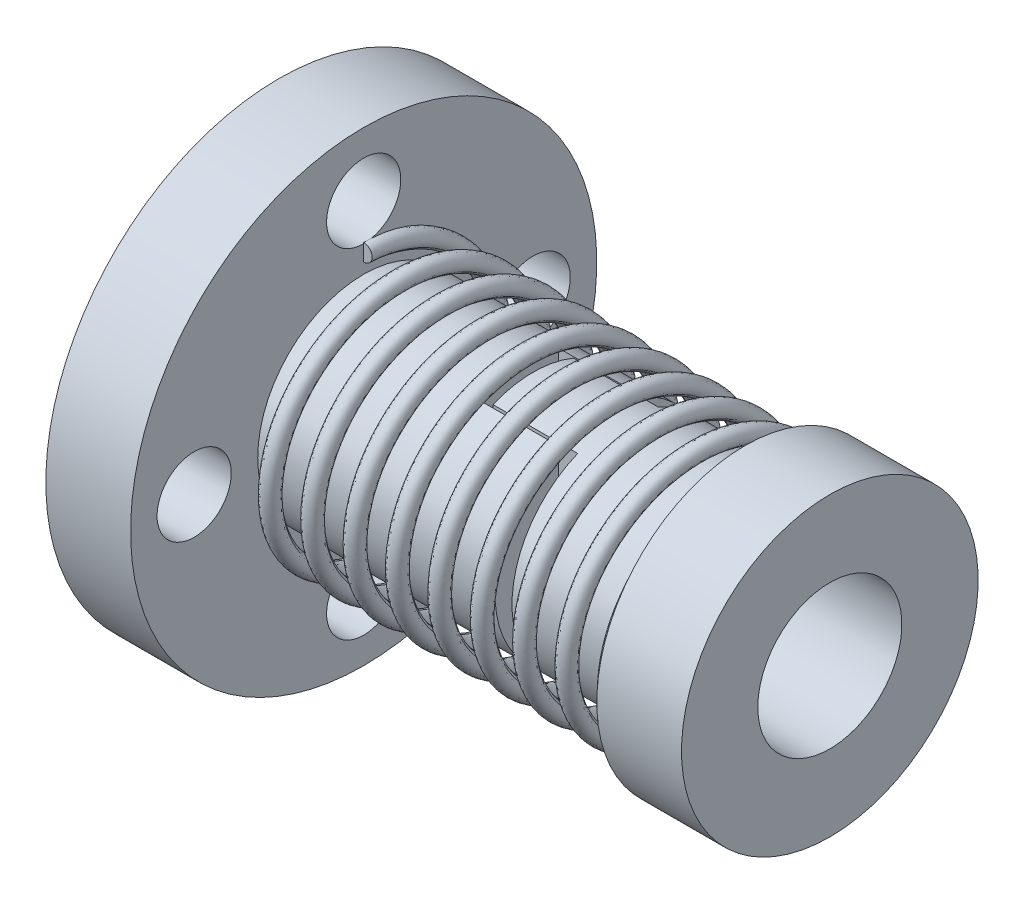
from build123d import *

# Parameters (mm, degrees)
CUT_EXTRUDE1_DEPTH      = 31.298514815
CUT_EXTRUDE1_DEPTH_BACK = 31.298514815
SWEEP1_PITCH            = 2
CUT_EXTRUDE2_DEPTH      = 31.298514888
CUT_EXTRUDE2_DEPTH_BACK = 4
SKETCH16_R              = 1.75


with BuildPart() as part:
    # Sketch1 → Revolve1 (revolve)
    with BuildSketch(Plane.XY, mode=Mode.PRIVATE) as revolve1_sk:
        Polygon((26, 0), (26, 7), (22, 7), (22, 5), (4, 5), (4, 11), (0, 11), (0, 0), align=None)
    revolve(revolve1_sk.sketch.rotate(Axis((0, 0, 0), (1, 0, 0)), 180), axis=Axis((0, 0, 0), (1, 0, 0)))

    # Sketch2 → Cut-Extrude1 (cut, two sides: drawn at the far end of the back side and taken through both)
    with BuildSketch(Plane(origin=(0, 0, 0), x_dir=(1, 0, 0), z_dir=(0, 1, 0)).offset(-CUT_EXTRUDE1_DEPTH_BACK)):
        Polygon((16, 6.9), (16, 1.9), (12, 1.9), (12, -1.9), (16, -1.9), (16, -6.9), (15.2, -6.9), (15.2, -2), (11.2, -2), (11.2, 2), (15.2, 2), (15.2, 6.9), align=None)
    extrude(amount=CUT_EXTRUDE1_DEPTH + CUT_EXTRUDE1_DEPTH_BACK, mode=Mode.SUBTRACT)


with BuildPart() as cut_extrude1_piece_1:
    # of the separate pieces the step leaves, piece 1, a body of its own (cut_extrude1_pieces)
    add(part.part.solids().sort_by_distance((11.2, -5, 0))[0])


with BuildPart() as cut_extrude1_piece_2:
    # of the separate pieces the step leaves, piece 2, a body of its own (cut_extrude1_pieces)
    add(part.part.solids().sort_by_distance((26, -7, 0))[0])


with BuildPart() as m8_tapped_hole3_tool:
    # Sketch12 → M8 Tapped Hole3 (revolve)
    with BuildSketch(Plane.ZX):
        Polygon((0, 0), (0, 26), (3.4, 26), (3.4, 0.625), (4.025, 0), align=None)
    revolve(axis=Axis((-6.35, 0, 0), (1, 0, 0)))


with BuildPart() as cut_extrude1_piece_1_1:
    add(cut_extrude1_piece_1.part)

    # M8 Tapped Hole3: cut by m8_tapped_hole3_tool
    add(m8_tapped_hole3_tool.part, mode=Mode.SUBTRACT)



with BuildPart() as cut_extrude1_piece_2_1:
    add(cut_extrude1_piece_2.part)

    # M8 Tapped Hole3: cut by m8_tapped_hole3_tool
    add(m8_tapped_hole3_tool.part, mode=Mode.SUBTRACT)


with BuildPart() as cut_extrude1_piece_1_2:
    add(cut_extrude1_piece_1_1.part)

    add(cut_extrude1_piece_2_1.part)  # Sweep1 merges Cut-Extrude1 piece 2
    # Sweep1: the profile of Sketch15 screwed along a left-hand helix of 9 turns, 10 arcs to a turn; built about Z, then put on its axis
    sweep1_z = Axis((0, 0, 0), (0, 0, 1))
    sweep1_corners = [(5.9, 0, 0.4), (6.3, 0, 0), (5.9, 0, -0.4), (5.5, 0, 0)]
    with BuildLine(mode=Mode.PRIVATE) as sweep1_profile:
        ThreePointArc((5.9, 0, 0.4), (6.182842712, 0, 0.282842712), (6.3, 0, 0))
        ThreePointArc((6.3, 0, 0), (6.182842712, 0, -0.282842712), (5.9, 0, -0.4))
        ThreePointArc((5.9, 0, -0.4), (5.617157288, 0, -0.282842712), (5.5, 0, 0))
        ThreePointArc((5.5, 0, 0), (5.617157288, 0, 0.282842712), (5.9, 0, 0.4))
    sweep1_cap = Face(sweep1_profile.wire())
    sweep1_arcs = [((5.9, 0, 0.4), (6.3, 0, 0.4), (6.3, 0, 0), (1, 0.7071067811865475, 1)), ((6.3, 0, 0), (6.3, 0, -0.4), (5.9, 0, -0.4), (1, 0.7071067811865475, 1)), ((5.9, 0, -0.4), (5.5, 0, -0.4), (5.5, 0, 0), (1, 0.7071067811865475, 1)), ((5.5, 0, 0), (5.5, 0, 0.4), (5.9, 0, 0.4), (1, 0.7071067811865475, 1))]  # start, shoulder, end, weights
    sweep1_turn_angles = [0, -18, -36, -54, -72, -90, -108, -126, -144, -162, -180, -198, -216, -234, -252, -270, -288, -306, -324, -342, -360]
    sweep1_turn_weights = [1, 0.9510565162951535, 1, 0.9510565162951535, 1, 0.9510565162951535, 1, 0.9510565162951535, 1, 0.9510565162951535, 1, 0.9510565162951535, 1, 0.9510565162951535, 1, 0.9510565162951535, 1, 0.9510565162951535, 1, 0.9510565162951535, 1]
    sweep1_turn_sides = [Face.make_bezier_surface([[Vector(p[j][0], p[j][1], 0).rotate(sweep1_z, sweep1_turn_angles[2 * i + k]) / sweep1_turn_weights[2 * i + k] + Vector(0, 0, p[j][2] + -SWEEP1_PITCH * sweep1_turn_angles[2 * i + k] / 360) for k in range(3)] for j in range(3)], [[p[3][j] * sweep1_turn_weights[2 * i + k] for k in range(3)] for j in range(3)]) for p in sweep1_arcs for i in range(10)]
    sweep1 = Plane(origin=(4, 0, 0), x_dir=(0, 1, 0), z_dir=(1, 0, 0)) * Solid(Shell([*[p.moved(Location((0, 0, SWEEP1_PITCH * i))) for i in range(9) for p in sweep1_turn_sides], sweep1_cap, sweep1_cap.rotate(sweep1_z, -3240).moved(Location((0, 0, -SWEEP1_PITCH * -3240 / 360)))]))
    add(sweep1)

    # Sketch16 → Cut-Extrude2 (cut, two sides: drawn at the far end of the back side and taken through both)
    with BuildSketch(Plane.ZY.offset(-CUT_EXTRUDE2_DEPTH_BACK)):
        with Locations(Location((0, 8, 0), (0, 0, 270))):
            Circle(SKETCH16_R)
        with Locations(Location((8, 0, 0), (0, 0, 270))):
            Circle(SKETCH16_R)
        with Locations(Location((0, -8, 0), (0, 0, 270))):
            Circle(SKETCH16_R)
        with Locations(Location((-8, 0, 0), (0, 0, 270))):
            Circle(SKETCH16_R)
    extrude(amount=CUT_EXTRUDE2_DEPTH + CUT_EXTRUDE2_DEPTH_BACK, mode=Mode.SUBTRACT)


solid = cut_extrude1_piece_1_2.part
